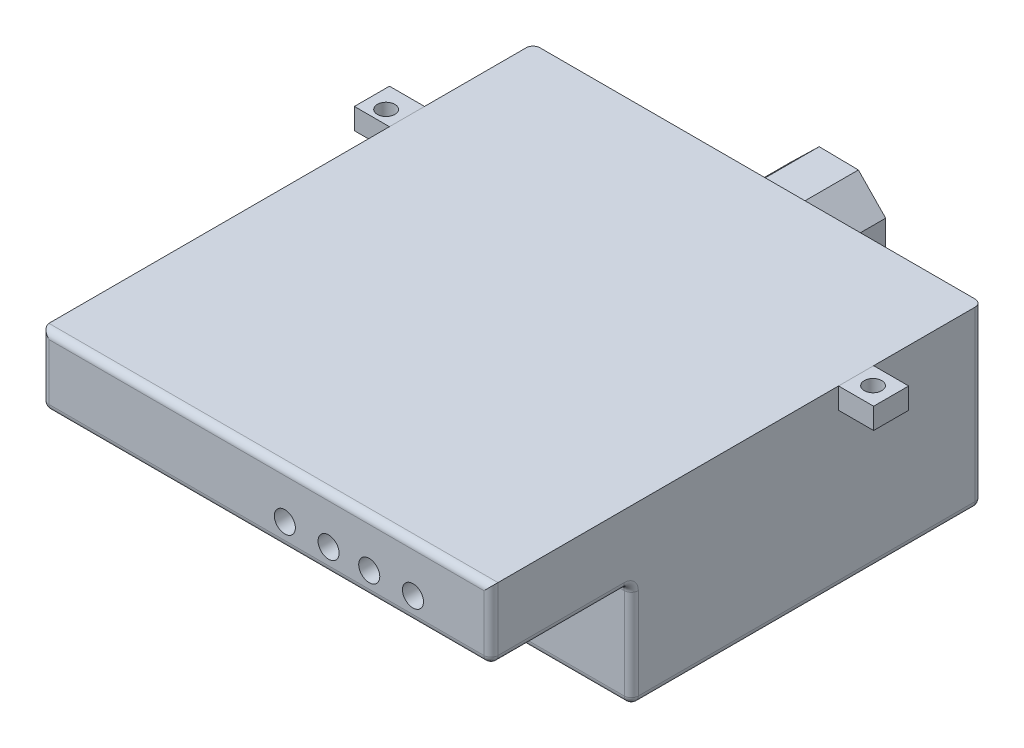
from build123d import *

# Parameters (mm, degrees)
SKETCH1_W               = 64
SKETCH1_H               = 70
BOSS_EXTRUDE1_DEPTH     = 10
SKETCH2_W               = 64
SKETCH2_H               = 50
BOSS_EXTRUDE2_DEPTH     = 15
FILLET1_R               = 1
FILLET2_R               = 1
FILLET3_R               = 1
BOSS_EXTRUDE6_DEPTH     = 12
SKETCH11_R              = 5
CUT_EXTRUDE2_DEPTH      = 12
SKETCH12_R              = 1.5
CUT_EXTRUDE3_DEPTH      = 5
SKETCH14_W              = 18.94793588
SKETCH14_H              = 7.949421375
BOSS_EXTRUDE9_DEPTH     = 3
CHAMFER1_SIZE           = 3
CHAMFER2_SIZE           = 2
FILLET4_R               = 0.5
SKETCH16_R              = 1.5
CUT_EXTRUDE5_DEPTH      = 6.5
SKETCH17_W              = 5
SKETCH17_H              = 5
BOSS_EXTRUDE10_DEPTH    = 3
BOSS_EXTRUDE10_2_DEPTH  = 3
CUT_EXTRUDE6_DEPTH      = 110.402925007
CUT_EXTRUDE6_DEPTH_BACK = 110.402925007
SKETCH18_R              = 1.25
SKETCH21_W              = 1.221153846
SKETCH21_H              = 0.325641025
SKETCH21_W_2            = 1.221153847
BOSS_EXTRUDE11_DEPTH    = 0.5


with BuildPart() as part:
    # Sketch1 → Boss-Extrude1 (new body)
    with BuildSketch(Plane(origin=(0, 0, 0), x_dir=(1, 0, 0), z_dir=(0, 1, 0))):
        with Locations((32, 35)):
            Rectangle(SKETCH1_W, SKETCH1_H)
    extrude(amount=-BOSS_EXTRUDE1_DEPTH)

    # Sketch2 → Boss-Extrude2 (add)
    with BuildSketch(Plane.XZ.offset(10)):
        with Locations((32, -45)):
            Rectangle(SKETCH2_W, SKETCH2_H)
    extrude(amount=BOSS_EXTRUDE2_DEPTH)

    # Fillet1
    fillet1_edges = [part.edges().sort_by_distance(p)[0] for p in [
        (32, -25, -20),
    ]]
    fillet(fillet1_edges, radius=FILLET1_R)

    # Fillet2
    fillet2_edges = [part.edges().sort_by_distance(p)[0] for p in [
        (32, -10, -20),
        (32, -25, -70),
        (32, -10, 0),
    ]]
    fillet(fillet2_edges, radius=FILLET2_R)

    # Fillet3
    fillet3_edges = [part.edges().sort_by_distance(p)[0] for p in [
        (0, -25, -45),
        (0, -17.5, -20),
        (0, -24.707106781, -20.292893219),
        (64, -17.5, -20),
        (64, -24.707106781, -20.292893219),
        (64, -25, -45),
        (64, -12, -70),
        (64, -4.5, 0),
        (64, -10, -10),
        (64, -9.707106781, -0.292893219),
        (64, -24.707106781, -69.707106781),
        (0, -12, -70),
        (0, -10, -10),
        (0, -4.5, 0),
        (0, -9.707106781, -0.292893219),
        (0, -24.707106781, -69.707106781),
        (0, -10.292893219, -19.707106781),
        (64, -10.292893219, -19.707106781),
        (32, 0, 0),
    ]]
    fillet(fillet3_edges, radius=FILLET3_R)

    # Sketch9 → Boss-Extrude6 (add)
    with BuildSketch(Plane(origin=(0, 0, -70), x_dir=(-1, 0, 0), z_dir=(0, 0, -1))):
        Polygon((-34.364326887, -4.389884194), (-38.254799856, -8.395303948), (-38.173520205, -13.978543236), (-34.168100451, -17.869016205), (-28.584861163, -17.787736554), (-24.694388194, -13.7823168), (-24.775667845, -8.199077512), (-28.781087599, -4.308604543), align=None)
    extrude(amount=BOSS_EXTRUDE6_DEPTH)

    # Sketch11 → Cut-Extrude2 (cut)
    with BuildSketch(Plane(origin=(0, 0, -82), x_dir=(-1, 0, 0), z_dir=(0, 0, -1))):
        with Locations((-31.683922524, -10.888004874)):
            Circle(SKETCH11_R)
    extrude(amount=-CUT_EXTRUDE2_DEPTH, mode=Mode.SUBTRACT)

    # Sketch12 → Cut-Extrude3 (cut)
    with BuildSketch(Plane.XZ.offset(10)):
        with Locations(Location((53.003361891, -6.938186349, 0), (0, 0, 270))):
            Circle(SKETCH12_R)
        with Locations(Location((46.690876077, -6.938186349, 0), (0, 0, 270))):
            Circle(SKETCH12_R)
        with Locations(Location((41.067025079, -6.938186349, 0), (0, 0, 270))):
            Circle(SKETCH12_R)
        with Locations(Location((34.869311734, -6.938186349, 0), (0, 0, 270))):
            Circle(SKETCH12_R)
    extrude(amount=-CUT_EXTRUDE3_DEPTH, mode=Mode.SUBTRACT)

    # Sketch14 → Boss-Extrude9 (add)
    with BuildSketch(Plane.XZ.offset(10)):
        with Locations((21.328174045, -7.351079386)):
            Rectangle(SKETCH14_W, SKETCH14_H)
    extrude(amount=BOSS_EXTRUDE9_DEPTH)

    # Chamfer1
    chamfer1_edges = [part.edges().sort_by_distance(p)[0] for p in [
        (11.854206105, -13, -7.351079386),
    ]]
    chamfer(chamfer1_edges, length=CHAMFER1_SIZE - 0.0001)  # a hair under: the kernel refuses the full size

    # Chamfer2
    chamfer2_edges = [part.edges().sort_by_distance(p)[0] for p in [
        (30.802141985, -13, -7.351079386),
    ]]
    chamfer(chamfer2_edges, length=CHAMFER2_SIZE)

    # Fillet4
    fillet4_edges = [part.edges().sort_by_distance(p)[0] for p in [
        (21.828124045, -13, -11.325790073),
        (21.828124045, -13, -3.376368698),
    ]]
    fillet(fillet4_edges, radius=FILLET4_R)

    # Sketch16 → Cut-Extrude5 (cut)
    with BuildSketch(Plane.XY):
        with Locations((34.627532935, -6.686422518)):
            Circle(SKETCH16_R)
        with Locations((40.859258416, -6.686422518)):
            Circle(SKETCH16_R)
        with Locations((46.653669829, -6.686422518)):
            Circle(SKETCH16_R)
        with Locations((52.88539531, -6.686422518)):
            Circle(SKETCH16_R)
    extrude(amount=-CUT_EXTRUDE5_DEPTH, mode=Mode.SUBTRACT)

    # Sketch21 → Boss-Extrude11 (add)
    with BuildSketch(Plane.XZ.offset(10)):
        Polygon((34.012491526, -9.096976569), (34.320960076, -9.096976569), (35.091177423, -10.78623939), (35.861394771, -9.096976569), (36.169863321, -9.096976569), (35.111529988, -11.417168877), (35.070824859, -11.417168877), align=None)
        Polygon((37.513132552, -9.707553492), (37.513132552, -8.771335543), (37.798068449, -8.771335543), (37.798068449, -9.707553492), (38.734286398, -9.707553492), (38.734286398, -9.99248939), (37.798068449, -9.99248939), (37.798068449, -10.928707338), (37.513132552, -10.928707338), (37.513132552, -9.99248939), (36.576914603, -9.99248939), (36.576914603, -9.707553492), align=None)
        Polygon((40.321786398, -9.096976569), (40.630254947, -9.096976569), (41.400472295, -10.78623939), (42.170689643, -9.096976569), (42.479158193, -9.096976569), (41.420824859, -11.417168877), (41.380119731, -11.417168877), align=None)
        with Locations((43.374671013, -10.19601503)):
            Rectangle(SKETCH21_W, SKETCH21_H)
        with BuildLine():
            Line((44.433004347, -9.096976569), (44.717940244, -9.096976569))
            Line((44.717940244, -9.096976569), (44.717940244, -9.500211745))
            add(Edge.make_bspline(
                [(44.717940244, -9.500211745), (44.743597827, -9.464935135), (44.792760216, -9.397341768), (44.873374058, -9.308269153), (44.953906674, -9.232678613), (45.011903385, -9.192997579), (45.039765164, -9.173934702)],
                knots=[0, 0, 0, 0, 1.134379233, 2.173579362, 3.122582517, 4, 4, 4, 4], degree=3))
            add(Edge.make_bspline(
                [(45.039765164, -9.173934702), (45.077742393, -9.155786978), (45.153033345, -9.119808591), (45.272249356, -9.083311006), (45.394237092, -9.060881807), (45.476613115, -9.057814418), (45.51805042, -9.056271441)],
                knots=[0, 0, 0, 0, 1.014936303, 2.012140481, 3.000054389, 4, 4, 4, 4], degree=3))
            add(Edge.make_bspline(
                [(45.51805042, -9.056271441), (45.546074781, -9.057219669), (45.601533485, -9.059096161), (45.683706196, -9.071306336), (45.763406508, -9.092412079), (45.84016352, -9.121810151), (45.912481565, -9.157412503), (45.978783908, -9.199186166), (46.03831444, -9.246082799), (46.091043072, -9.300220117), (46.138458545, -9.363118317), (46.182072928, -9.436473743), (46.222372942, -9.52193355), (46.244707986, -9.583951769), (46.256466887, -9.616602971)],
                knots=[0, 0, 0, 0, 1.009824226, 1.998387844, 2.986035974, 3.974953746, 4.955485308, 5.885931332, 6.793869504, 7.679848016, 8.601185859, 9.625726857, 10.749998409, 12, 12, 12, 12], degree=3))
            add(Edge.make_bspline(
                [(46.256466887, -9.616602971), (46.26890495, -9.594174391), (46.293381313, -9.550038095), (46.334479998, -9.487573814), (46.377540071, -9.429147653), (46.422928504, -9.374713253), (46.470485093, -9.324539427), (46.520433649, -9.278460287), (46.572489844, -9.23627795), (46.644872804, -9.186999084), (46.739045669, -9.13465587), (46.857779888, -9.089272924), (46.981287543, -9.061227579), (47.065123598, -9.057934403), (47.107458473, -9.056271441)],
                knots=[0, 0, 0, 0, 0.86119277, 1.694706429, 2.50939023, 3.298075842, 4.073795165, 4.829715201, 5.57930267, 6.321991688, 7.768977793, 9.186738141, 10.579381044, 12, 12, 12, 12], degree=3))
            add(Edge.make_bspline(
                [(47.107458473, -9.056271441), (47.146358086, -9.057738491), (47.222488405, -9.060609651), (47.333320639, -9.083155302), (47.436682134, -9.121870025), (47.53236491, -9.174696252), (47.618688455, -9.241080226), (47.693723964, -9.3200641), (47.757015651, -9.411089193), (47.798361988, -9.496716212), (47.826406549, -9.572313264), (47.843697812, -9.636726114), (47.858973821, -9.707620737), (47.871656808, -9.785081902), (47.880926494, -9.86938324), (47.887794215, -9.960386792), (47.892442481, -10.058163286), (47.892770933, -10.125623418), (47.892940244, -10.160398043)],
                knots=[0, 0, 0, 0, 1.209669288, 2.367440248, 3.500751976, 4.631527125, 5.755587489, 6.87532382, 8.007944318, 9.190864318, 9.82315674, 10.514484317, 11.263564316, 12.079023757, 12.955305781, 13.901327259, 14.918167583, 16, 16, 16, 16], degree=3))
            Line((47.892940244, -10.160398043), (47.892940244, -11.417168877))
            Line((47.892940244, -11.417168877), (47.608004347, -11.417168877))
            Line((47.608004347, -11.417168877), (47.608004347, -10.159126008))
            add(Edge.make_bspline(
                [(47.608004347, -10.159126008), (47.607933696, -10.129443773), (47.607797915, -10.072399032), (47.605354406, -9.990527165), (47.600750372, -9.915898013), (47.595366806, -9.848613333), (47.587888494, -9.788516218), (47.578231113, -9.735727381), (47.568000646, -9.689831566), (47.551004425, -9.638953509), (47.523837409, -9.582828389), (47.482455838, -9.522300574), (47.430322242, -9.469612991), (47.3701241, -9.423876375), (47.301590868, -9.386689286), (47.226057869, -9.360131763), (47.143994051, -9.343691723), (47.087186236, -9.342053409), (47.057849098, -9.341207338)],
                knots=[0, 0, 0, 0, 1.253487763, 2.409012846, 3.458416907, 4.410876679, 5.259312806, 6.014470957, 6.676830364, 7.243083969, 8.276244668, 9.299465089, 10.325150304, 11.392391894, 12.482080715, 13.603491619, 14.762376348, 16, 16, 16, 16], degree=3))
            add(Edge.make_bspline(
                [(47.057849098, -9.341207338), (47.021862782, -9.342491995), (46.950740142, -9.345030966), (46.846921736, -9.370951551), (46.747162314, -9.410031492), (46.654438586, -9.46666665), (46.569141948, -9.534528523), (46.495754473, -9.615218513), (46.435128134, -9.706504233), (46.394076313, -9.791001598), (46.368141732, -9.866901737), (46.351017673, -9.933211496), (46.337697739, -10.008578347), (46.325205902, -10.092495856), (46.317052749, -10.185541663), (46.309642868, -10.287285355), (46.3061768, -10.398032947), (46.305691969, -10.474801443), (46.305440244, -10.514659862)],
                knots=[0, 0, 0, 0, 1.090531906, 2.155305635, 3.229839962, 4.33261226, 5.44038871, 6.529323825, 7.629011124, 8.757537029, 9.370236727, 10.061839251, 10.834451254, 11.692844982, 12.636905849, 13.66920014, 14.789842145, 16, 16, 16, 16], degree=3))
            Line((46.305440244, -10.514659862), (46.305440244, -11.417168877))
            Line((46.305440244, -11.417168877), (46.020504347, -11.417168877))
            Line((46.020504347, -11.417168877), (46.020504347, -10.237356176))
            add(Edge.make_bspline(
                [(46.020504347, -10.237356176), (46.020432291, -10.204070094), (46.020293664, -10.140031018), (46.017865862, -10.048197613), (46.01325157, -9.964666919), (46.007917072, -9.889536019), (46.000242482, -9.822941457), (45.991525055, -9.764526212), (45.981230244, -9.714436731), (45.964185134, -9.659497089), (45.938137009, -9.59897168), (45.896237657, -9.534436611), (45.843979352, -9.477950551), (45.782682915, -9.429727972), (45.713734903, -9.389866771), (45.637549961, -9.361146853), (45.554814076, -9.344433391), (45.497775014, -9.342302969), (45.468441045, -9.341207338)],
                knots=[0, 0, 0, 0, 1.320475261, 2.540461679, 3.643808994, 4.639130445, 5.527981419, 6.302341397, 6.981980563, 7.553956391, 8.582137848, 9.585246428, 10.591171744, 11.620968678, 12.668337649, 13.738356861, 14.836885341, 16, 16, 16, 16], degree=3))
            add(Edge.make_bspline(
                [(45.468441045, -9.341207338), (45.433954911, -9.342595684), (45.365225269, -9.345362608), (45.264258482, -9.370267557), (45.166753612, -9.409278396), (45.074266135, -9.463398375), (44.989290301, -9.530435396), (44.914897087, -9.609279623), (44.852356367, -9.698949817), (44.810871078, -9.7825562), (44.784111748, -9.856554814), (44.76633598, -9.919466031), (44.751060034, -9.989316256), (44.739708028, -10.066320992), (44.728749366, -10.149978699), (44.723460442, -10.240706129), (44.718315525, -10.338425452), (44.718068406, -10.405891975), (44.717940244, -10.440881817)],
                knots=[0, 0, 0, 0, 1.098833095, 2.189935336, 3.297829714, 4.440610912, 5.596351641, 6.740013378, 7.886572111, 9.072425424, 9.705826452, 10.395263256, 11.156850408, 11.985370555, 12.878090359, 13.847760091, 14.883794034, 16, 16, 16, 16], degree=3))
            Line((44.717940244, -10.440881817), (44.717940244, -11.417168877))
            Line((44.717940244, -11.417168877), (44.433004347, -11.417168877))
            Line((44.433004347, -11.417168877), (44.433004347, -9.096976569))
        make_face()
        Polygon((49.399029988, -9.707553492), (49.399029988, -8.771335543), (49.683965885, -8.771335543), (49.683965885, -9.707553492), (50.620183834, -9.707553492), (50.620183834, -9.99248939), (49.683965885, -9.99248939), (49.683965885, -10.928707338), (49.399029988, -10.928707338), (49.399029988, -9.99248939), (48.462812039, -9.99248939), (48.462812039, -9.707553492), align=None)
        with BuildLine():
            Line((51.230760757, -9.096976569), (51.515696654, -9.096976569))
            Line((51.515696654, -9.096976569), (51.515696654, -9.500211745))
            add(Edge.make_bspline(
                [(51.515696654, -9.500211745), (51.541354237, -9.464935135), (51.590516626, -9.397341768), (51.671130468, -9.308269153), (51.751663085, -9.232678613), (51.809659795, -9.192997579), (51.837521574, -9.173934702)],
                knots=[0, 0, 0, 0, 1.134379233, 2.173579362, 3.122582517, 4, 4, 4, 4], degree=3))
            add(Edge.make_bspline(
                [(51.837521574, -9.173934702), (51.875498803, -9.155786978), (51.950789755, -9.119808591), (52.070005766, -9.083311006), (52.191993502, -9.060881807), (52.274369525, -9.057814418), (52.31580683, -9.056271441)],
                knots=[0, 0, 0, 0, 1.014936303, 2.012140481, 3.000054389, 4, 4, 4, 4], degree=3))
            add(Edge.make_bspline(
                [(52.31580683, -9.056271441), (52.343831192, -9.057219669), (52.399289896, -9.059096161), (52.481462606, -9.071306336), (52.561162918, -9.092412079), (52.63791993, -9.121810151), (52.710237975, -9.157412503), (52.776540319, -9.199186166), (52.83607085, -9.246082799), (52.888799483, -9.300220117), (52.936214956, -9.363118317), (52.979829338, -9.436473743), (53.020129352, -9.52193355), (53.042464397, -9.583951769), (53.054223297, -9.616602971)],
                knots=[0, 0, 0, 0, 1.009824226, 1.998387844, 2.986035974, 3.974953746, 4.955485308, 5.885931332, 6.793869504, 7.679848016, 8.601185859, 9.625726857, 10.749998409, 12, 12, 12, 12], degree=3))
            add(Edge.make_bspline(
                [(53.054223297, -9.616602971), (53.066661361, -9.594174391), (53.091137723, -9.550038095), (53.132236408, -9.487573814), (53.175296481, -9.429147653), (53.220684914, -9.374713253), (53.268241503, -9.324539427), (53.318190059, -9.278460287), (53.370246254, -9.23627795), (53.442629214, -9.186999084), (53.53680208, -9.13465587), (53.655536298, -9.089272924), (53.779043954, -9.061227579), (53.862880009, -9.057934403), (53.905214883, -9.056271441)],
                knots=[0, 0, 0, 0, 0.86119277, 1.694706429, 2.50939023, 3.298075842, 4.073795165, 4.829715201, 5.57930267, 6.321991688, 7.768977793, 9.186738141, 10.579381044, 12, 12, 12, 12], degree=3))
            add(Edge.make_bspline(
                [(53.905214883, -9.056271441), (53.944114496, -9.057738491), (54.020244815, -9.060609651), (54.131077049, -9.083155302), (54.234438544, -9.121870025), (54.33012132, -9.174696252), (54.416444865, -9.241080226), (54.491480374, -9.3200641), (54.554772061, -9.411089193), (54.596118398, -9.496716212), (54.624162959, -9.572313264), (54.641454222, -9.636726114), (54.656730231, -9.707620737), (54.669413218, -9.785081902), (54.678682904, -9.86938324), (54.685550625, -9.960386792), (54.690198892, -10.058163286), (54.690527343, -10.125623418), (54.690696654, -10.160398043)],
                knots=[0, 0, 0, 0, 1.209669288, 2.367440248, 3.500751976, 4.631527125, 5.755587489, 6.87532382, 8.007944318, 9.190864318, 9.82315674, 10.514484317, 11.263564316, 12.079023757, 12.955305781, 13.901327259, 14.918167583, 16, 16, 16, 16], degree=3))
            Line((54.690696654, -10.160398043), (54.690696654, -11.417168877))
            Line((54.690696654, -11.417168877), (54.405760757, -11.417168877))
            Line((54.405760757, -11.417168877), (54.405760757, -10.159126008))
            add(Edge.make_bspline(
                [(54.405760757, -10.159126008), (54.405690106, -10.129443773), (54.405554325, -10.072399032), (54.403110817, -9.990527165), (54.398506782, -9.915898013), (54.393123217, -9.848613333), (54.385644904, -9.788516218), (54.375987523, -9.735727381), (54.365757056, -9.689831566), (54.348760836, -9.638953509), (54.32159382, -9.582828389), (54.280212249, -9.522300574), (54.228078652, -9.469612991), (54.16788051, -9.423876375), (54.099347278, -9.386689286), (54.023814279, -9.360131763), (53.941750461, -9.343691723), (53.884942646, -9.342053409), (53.855605508, -9.341207338)],
                knots=[0, 0, 0, 0, 1.253487763, 2.409012846, 3.458416907, 4.410876679, 5.259312806, 6.014470957, 6.676830364, 7.243083969, 8.276244668, 9.299465089, 10.325150304, 11.392391894, 12.482080715, 13.603491619, 14.762376348, 16, 16, 16, 16], degree=3))
            add(Edge.make_bspline(
                [(53.855605508, -9.341207338), (53.819619193, -9.342491995), (53.748496552, -9.345030966), (53.644678146, -9.370951551), (53.544918724, -9.410031492), (53.452194996, -9.46666665), (53.366898358, -9.534528523), (53.293510884, -9.615218513), (53.232884544, -9.706504233), (53.191832723, -9.791001598), (53.165898142, -9.866901737), (53.148774083, -9.933211496), (53.135454149, -10.008578347), (53.122962312, -10.092495856), (53.114809159, -10.185541663), (53.107399278, -10.287285355), (53.10393321, -10.398032947), (53.10344838, -10.474801443), (53.103196654, -10.514659862)],
                knots=[0, 0, 0, 0, 1.090531906, 2.155305635, 3.229839962, 4.33261226, 5.44038871, 6.529323825, 7.629011124, 8.757537029, 9.370236727, 10.061839251, 10.834451254, 11.692844982, 12.636905849, 13.66920014, 14.789842145, 16, 16, 16, 16], degree=3))
            Line((53.103196654, -10.514659862), (53.103196654, -11.417168877))
            Line((53.103196654, -11.417168877), (52.818260757, -11.417168877))
            Line((52.818260757, -11.417168877), (52.818260757, -10.237356176))
            add(Edge.make_bspline(
                [(52.818260757, -10.237356176), (52.818188702, -10.204070094), (52.818050074, -10.140031018), (52.815622272, -10.048197613), (52.81100798, -9.964666919), (52.805673482, -9.889536019), (52.797998892, -9.822941457), (52.789281465, -9.764526212), (52.778986654, -9.714436731), (52.761941544, -9.659497089), (52.735893419, -9.59897168), (52.693994067, -9.534436611), (52.641735762, -9.477950551), (52.580439325, -9.429727972), (52.511491313, -9.389866771), (52.435306371, -9.361146853), (52.352570486, -9.344433391), (52.295531424, -9.342302969), (52.266197455, -9.341207338)],
                knots=[0, 0, 0, 0, 1.320475261, 2.540461679, 3.643808994, 4.639130445, 5.527981419, 6.302341397, 6.981980563, 7.553956391, 8.582137848, 9.585246428, 10.591171744, 11.620968678, 12.668337649, 13.738356861, 14.836885341, 16, 16, 16, 16], degree=3))
            add(Edge.make_bspline(
                [(52.266197455, -9.341207338), (52.231711321, -9.342595684), (52.162981679, -9.345362608), (52.062014892, -9.370267557), (51.964510022, -9.409278396), (51.872022545, -9.463398375), (51.787046711, -9.530435396), (51.712653497, -9.609279623), (51.650112777, -9.698949817), (51.608627488, -9.7825562), (51.581868158, -9.856554814), (51.56409239, -9.919466031), (51.548816444, -9.989316256), (51.537464439, -10.066320992), (51.526505776, -10.149978699), (51.521216853, -10.240706129), (51.516071935, -10.338425452), (51.515824816, -10.405891975), (51.515696654, -10.440881817)],
                knots=[0, 0, 0, 0, 1.098833095, 2.189935336, 3.297829714, 4.440610912, 5.596351641, 6.740013378, 7.886572111, 9.072425424, 9.705826452, 10.395263256, 11.156850408, 11.985370555, 12.878090359, 13.847760091, 14.883794034, 16, 16, 16, 16], degree=3))
            Line((51.515696654, -10.440881817), (51.515696654, -11.417168877))
            Line((51.515696654, -11.417168877), (51.230760757, -11.417168877))
            Line((51.230760757, -11.417168877), (51.230760757, -9.096976569))
        make_face()
        with Locations((55.749029988, -10.19601503)):
            Rectangle(SKETCH21_W_2, SKETCH21_H)
    extrude(amount=BOSS_EXTRUDE11_DEPTH)


with BuildPart() as body_2:
    # Sketch17 → Boss-Extrude10 (new body)
    with BuildSketch(Plane(origin=(0, 0, 0), x_dir=(1, 0, 0), z_dir=(0, 1, 0))):
        with Locations((66.5, 52.034815129)):
            Rectangle(SKETCH17_W, SKETCH17_H)
    extrude(amount=-BOSS_EXTRUDE10_DEPTH)


with BuildPart() as body_3:
    # Sketch17 → Boss-Extrude10 2 (new body)
    with BuildSketch(Plane(origin=(0, 0, 0), x_dir=(1, 0, 0), z_dir=(0, 1, 0))):
        with Locations((-2.5, 52.034815129)):
            Rectangle(SKETCH17_W, SKETCH17_H)
    extrude(amount=-BOSS_EXTRUDE10_2_DEPTH)


with BuildPart() as cut_extrude6_tool:
    # Sketch18 → Cut-Extrude6 (new, two sides: drawn at the far end of the back side and taken through both)
    with BuildSketch(Plane.XZ.offset(3).offset(-CUT_EXTRUDE6_DEPTH_BACK)):
        with Locations(Location((-2.374451335, -51.431440713, 0), (0, 0, 270))):
            Circle(SKETCH18_R)
        with Locations(Location((66.421331219, -52.034815129, 0), (0, 0, 270))):
            Circle(SKETCH18_R)
    extrude(amount=CUT_EXTRUDE6_DEPTH + CUT_EXTRUDE6_DEPTH_BACK)


with BuildPart() as body_2_1:
    add(body_2.part)

    # Cut-Extrude6: cut by cut_extrude6_tool
    add(cut_extrude6_tool.part, mode=Mode.SUBTRACT)


with BuildPart() as body_3_1:
    add(body_3.part)

    # Cut-Extrude6: cut by cut_extrude6_tool
    add(cut_extrude6_tool.part, mode=Mode.SUBTRACT)


solid = Compound([part.part, body_2_1.part, body_3_1.part])
